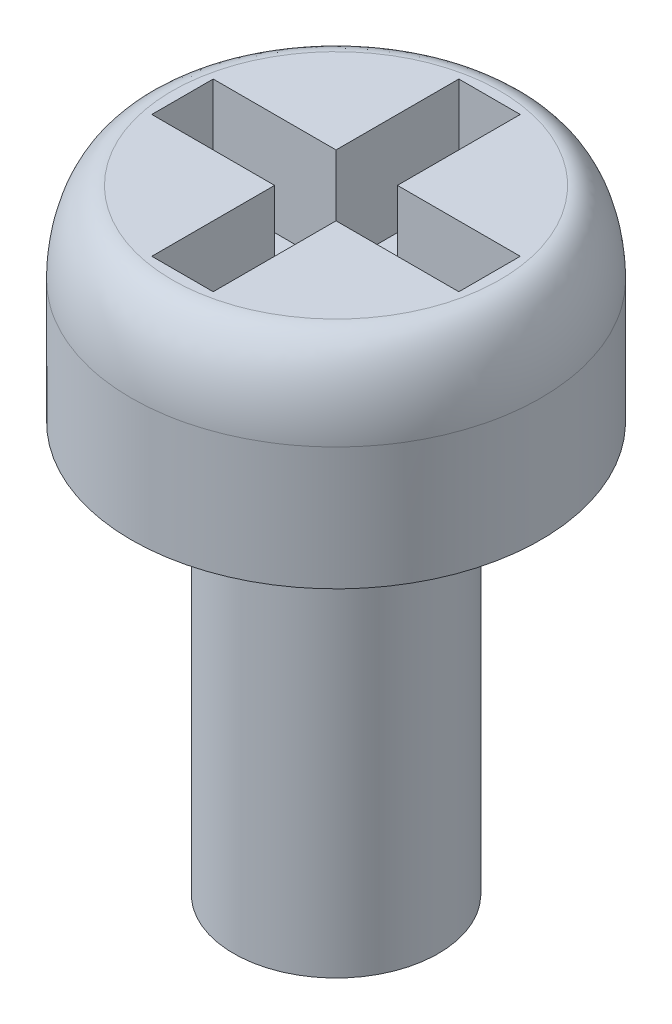
from build123d import *

# Parameters (mm, degrees)
SKETCH1_R           = 3
BOSS_EXTRUDE1_DEPTH = 3
SKETCH2_R           = 1.5
BOSS_EXTRUDE2_DEPTH = 6
CUT_EXTRUDE1_DEPTH  = 1.5
FILLET1_SIZE        = 1.2
FILLET1_SIZE_2      = 0.6


with BuildPart() as part:
    # Sketch1 → Boss-Extrude1 (new body)
    with BuildSketch(Plane(origin=(0, 0, 0), x_dir=(1, 0, 0), z_dir=(0, 1, 0))):
        with Locations(Location((0, 0, 0), (0, 0, 270))):
            Circle(SKETCH1_R)
    extrude(amount=BOSS_EXTRUDE1_DEPTH)

    # Sketch2 → Boss-Extrude2 (add)
    with BuildSketch(Plane.XZ):
        with Locations(Location((0, 0, 0), (0, 0, 270))):
            Circle(SKETCH2_R)
    extrude(amount=BOSS_EXTRUDE2_DEPTH)

    # Sketch3 → Cut-Extrude1 (cut)
    with BuildSketch(Plane(origin=(0, 3, 0), x_dir=(1, 0, 0), z_dir=(0, 1, 0))):
        Polygon((-0.45, 2.25), (-0.45, 0.45), (-2.25, 0.45), (-2.25, -0.45), (-0.45, -0.45), (-0.45, -2.25), (0.45, -2.25), (0.45, -0.45), (2.25, -0.45), (2.25, 0.45), (0.45, 0.45), (0.45, 2.25), align=None)
    extrude(amount=-CUT_EXTRUDE1_DEPTH, mode=Mode.SUBTRACT)

    # Fillet1
    # an asymmetric fillet: 1.2, 0.6 mm, written as the material it takes off along each edge
    with BuildSketch(Plane(origin=(0, 3, 0), x_dir=(0, 0, 1), z_dir=(-1, 0, 0))) as fillet1_piece_1:
        with BuildLine():
            Bezier((3, -FILLET1_SIZE), (3, 0), (3 - FILLET1_SIZE_2, 0), weights=[1, 0.707106781, 1])
            Line((3 - FILLET1_SIZE_2, 0), (3, 0))
            Line((3, 0), (3, -FILLET1_SIZE))
        make_face()
    revolve(axis=Axis((0, 3, 0), (0, 1, 0)), mode=Mode.SUBTRACT)


solid = part.part
